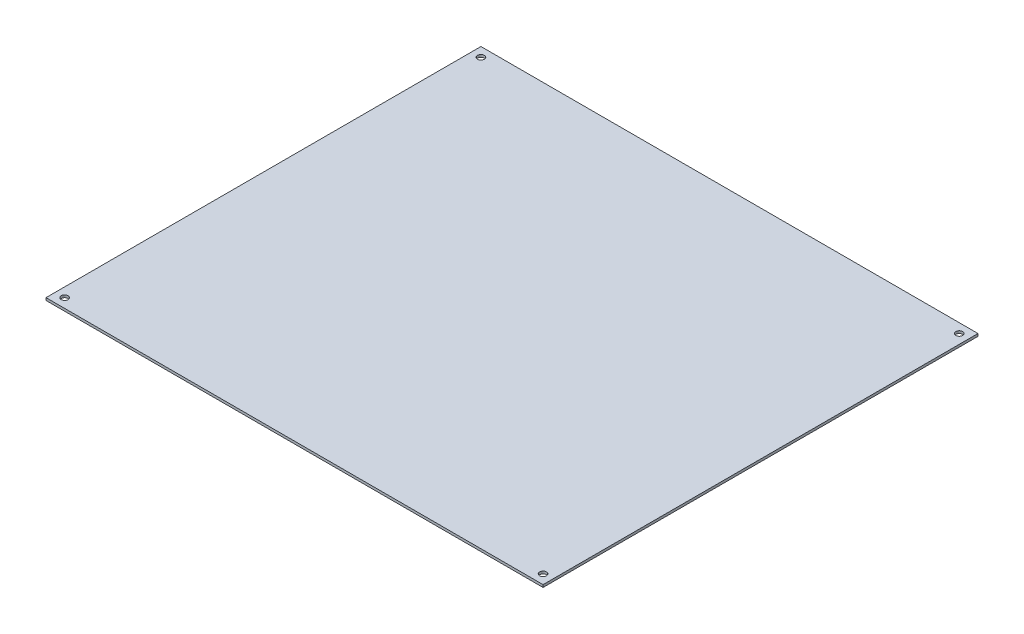
from build123d import *

# Parameters (mm, degrees)
SKETCH1_W           = 160
SKETCH1_H           = 140
SKETCH1_R           = 1.1
BOSS_EXTRUDE1_DEPTH = 0.8


with BuildPart() as part:
    # Sketch1 → Boss-Extrude1 (new body)
    with BuildSketch(Plane(origin=(0, 0, 0), x_dir=(1, 0, 0), z_dir=(0, 1, 0))):
        with Locations((80, 70)):
            Rectangle(SKETCH1_W, SKETCH1_H)
        with Locations((3, 3)):
            Circle(SKETCH1_R, mode=Mode.SUBTRACT)
        with Locations((3, 137)):
            Circle(SKETCH1_R, mode=Mode.SUBTRACT)
        with Locations((157, 137)):
            Circle(SKETCH1_R, mode=Mode.SUBTRACT)
        with Locations((157, 3)):
            Circle(SKETCH1_R, mode=Mode.SUBTRACT)
    extrude(amount=BOSS_EXTRUDE1_DEPTH)


solid = part.part
